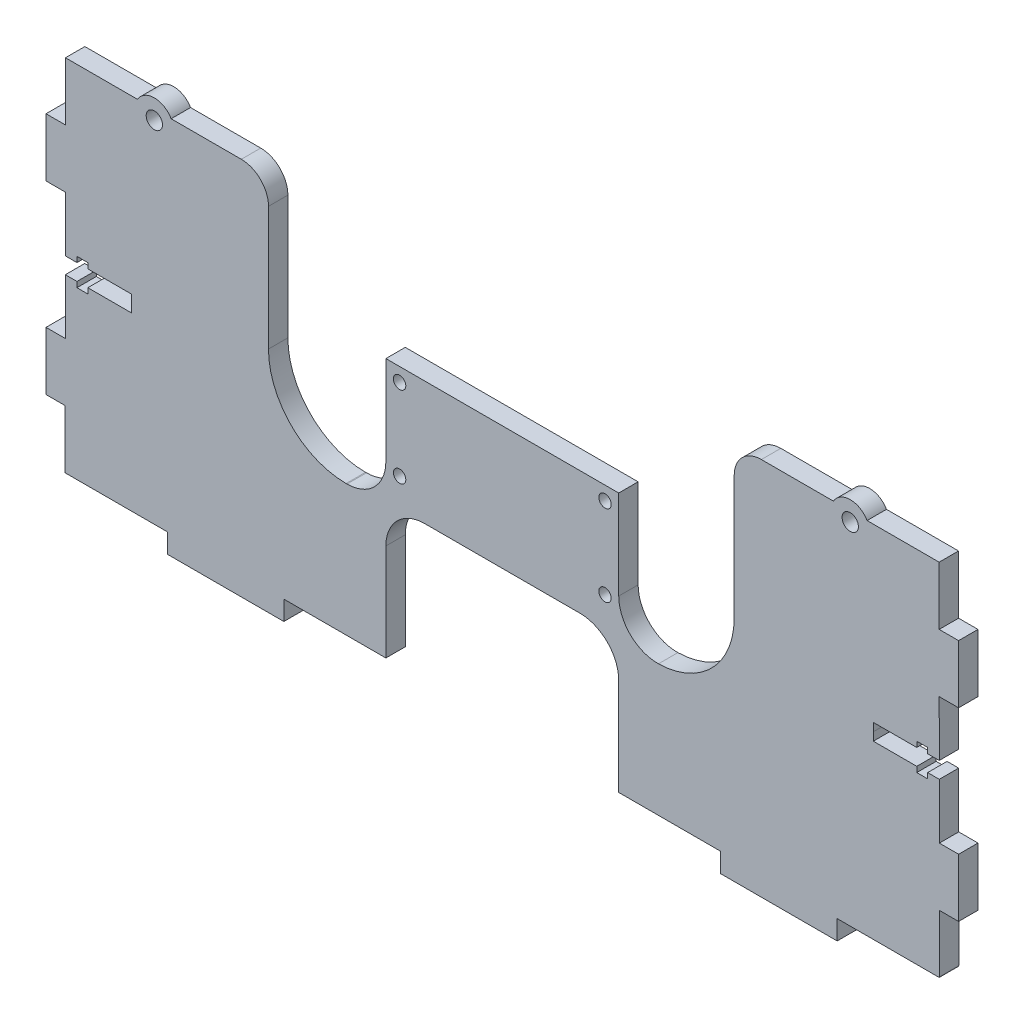
from build123d import *

# Parameters (mm, degrees)
BOSS_EXTRUDE1_DEPTH     = 5
BOSS_EXTRUDE2_START     = -5
BOSS_EXTRUDE2_DEPTH     = 5
CUT_EXTRUDE1_DEPTH      = 5
FILLET1_R               = 7
SKETCH5_W               = 60
SKETCH5_H               = 33
BOSS_EXTRUDE3_DEPTH     = 5
SKETCH6_R               = 1.6
CUT_EXTRUDE2_DEPTH      = 5
CUT_EXTRUDE3_START      = -5
CUT_EXTRUDE3_DEPTH      = 5
CUT_EXTRUDE4_DEPTH      = 10
FILLET2_R               = 10
BOSS_EXTRUDE5_START     = -5
BOSS_EXTRUDE5_OUTLINE_W = 30
BOSS_EXTRUDE5_OUTLINE_H = 5
BOSS_EXTRUDE5_DEPTH     = 5
SKETCH12_W              = 5
SKETCH12_H              = 92.666318873
BOSS_EXTRUDE6_DEPTH     = 5
SKETCH13_W              = 5
SKETCH13_H              = 92.479626066
BOSS_EXTRUDE7_DEPTH     = 11
SKETCH14_W              = 14.125243299
SKETCH14_H              = 18.417399827
SKETCH14_W_2            = 17.448829958
BOSS_EXTRUDE8_DEPTH     = 5
CUT_EXTRUDE5_DEPTH      = 5
SKETCH17_W              = 6.263528668
SKETCH17_H              = 4.2
SKETCH17_W_2            = 6.634448871
CUT_EXTRUDE6_DEPTH      = 5
BOSS_EXTRUDE9_DEPTH     = 5
CUT_EXTRUDE7_DEPTH      = 5
SKETCH21_W              = 3.746111535
SKETCH21_H              = 4.198684894
SKETCH21_W_2            = 4.081394213
SKETCH21_H_2            = 4.198442995
CUT_EXTRUDE8_DEPTH      = 5
BOSS_EXTRUDE10_DEPTH    = 5
SKETCH23_R              = 2.1
CUT_EXTRUDE9_DEPTH      = 5


# Read off the part's stored shape, not the designer's step: Cut-Extrude3, Boss-Extrude5
with BuildPart() as part:
    # Sketch1 → Boss-Extrude1 (new body)
    with BuildSketch(Plane.XY):
        with BuildLine():
            Line((-112.555529977, 89.947234922), (-112.567255319, 76.117234919))
            Line((-112.567255319, 76.117234919), (-109.550918722, 76.117234919))
            Line((-109.550918722, 76.117234919), (-109.550918722, 77.517234919))
            Line((-109.550918722, 77.517234919), (-106.750918722, 77.517234919))
            Line((-106.750918722, 77.517234919), (-106.750918722, 76.117234919))
            Line((-106.750918722, 76.117234919), (-95.550918722, 76.117234919))
            Line((-95.550918722, 76.117234919), (-95.550918722, 71.917234919))
            Line((-95.550918722, 71.917234919), (-106.750918722, 71.917234919))
            Line((-106.750918722, 71.917234919), (-106.750918722, 70.517234919))
            Line((-106.750918722, 70.517234919), (-109.550918722, 70.517234919))
            Line((-109.550918722, 70.517234919), (-109.550918722, 71.917234919))
            Line((-109.550918722, 71.917234919), (-112.5683672, 71.917234919))
            Line((-112.5683672, 71.917234919), (-112.56855454, 63.078549452))
            Line((-112.56855454, 63.078549452), (-112.56855454, 58.070468723))
            ThreePointArc((-112.56855454, 58.070468723), (-109.295273663, 56.47724277), (-107.97, 53.086610624))
            Line((-107.97, 53.086610624), (-107.97, -29.899029756))
            ThreePointArc((-107.97, -29.899029756), (-109.295765386, -33.290194747), (-112.57, -34.883004073))
            Line((-112.57, -34.883004073), (-112.57, -63.301209568))
            Line((-112.57, -63.301209568), (-109.57, -63.301209568))
            Line((-109.57, -63.301209568), (-109.57, -61.901209568))
            Line((-109.57, -61.901209568), (-106.77, -61.901209568))
            Line((-106.77, -61.901209568), (-106.77, -63.301209568))
            Line((-106.77, -63.301209568), (-95.57, -63.301209568))
            Line((-95.57, -63.301209568), (-95.57, -67.501209568))
            Line((-95.57, -67.501209568), (-106.77, -67.501209568))
            Line((-106.77, -67.501209568), (-106.77, -68.901209568))
            Line((-106.77, -68.901209568), (-109.57, -68.901209568))
            Line((-109.57, -68.901209568), (-109.57, -67.501209568))
            Line((-109.57, -67.501209568), (-112.57, -67.501209568))
            Line((-112.57, -67.501209568), (-112.57, -90.906209566))
            Line((-112.57, -90.906209566), (-94.225, -90.906209566))
            Line((-94.225, -90.906209566), (-94.225, -87.906209568))
            Line((-94.225, -87.906209568), (-95.625, -87.906209568))
            Line((-95.625, -87.906209568), (-95.625, -85.106209568))
            Line((-95.625, -85.106209568), (-94.225, -85.106209568))
            Line((-94.225, -85.106209568), (-94.225, -73.906209568))
            Line((-94.225, -73.906209568), (-90.025, -73.906209568))
            Line((-90.025, -73.906209568), (-90.025, -85.106209568))
            Line((-90.025, -85.106209568), (-88.625, -85.106209568))
            Line((-88.625, -85.106209568), (-88.625, -87.906209568))
            Line((-88.625, -87.906209568), (-90.025, -87.906209568))
            Line((-90.025, -87.906209568), (-90.025, -90.906209566))
            Line((-90.025, -90.906209566), (-74.478184725, -90.906209566))
            Line((-74.478184725, -90.906209566), (-58.579544248, -63.368956488))
            Line((-58.579544248, -63.368956488), (-61.177620458, -61.868956489))
            Line((-61.177620458, -61.868956489), (-61.877620458, -63.081392054))
            Line((-61.877620458, -63.081392054), (-64.302491589, -61.681392054))
            Line((-64.302491589, -61.681392054), (-63.602491589, -60.468956489))
            Line((-63.602491589, -60.468956489), (-73.301976111, -54.868956489))
            Line((-73.301976111, -54.868956489), (-71.201976111, -51.231649793))
            Line((-71.201976111, -51.231649793), (-61.502491589, -56.831649793))
            Line((-61.502491589, -56.831649793), (-60.802491589, -55.619214227))
            Line((-60.802491589, -55.619214227), (-58.377620458, -57.019214227))
            Line((-58.377620458, -57.019214227), (-59.077620458, -58.231649793))
            Line((-59.077620458, -58.231649793), (-56.479544248, -59.731649792))
            Line((-56.479544248, -59.731649792), (-39.837168574, -30.906209566))
            Line((-39.837168574, -30.906209566), (-2.099582772, -30.906209566))
            Line((-2.099582772, -30.906209566), (-2.099582772, -27.906209566))
            Line((-2.099582772, -27.906209566), (-3.499582772, -27.906209566))
            Line((-3.499582772, -27.906209566), (-3.499582772, -25.106209566))
            Line((-3.499582772, -25.106209566), (-2.099582772, -25.106209566))
            Line((-2.099582772, -25.106209566), (-2.099582772, -13.906209566))
            Line((-2.099582772, -13.906209566), (2.100417228, -13.906209566))
            Line((2.100417228, -13.906209566), (2.100417228, -25.106209566))
            Line((2.100417228, -25.106209566), (3.500417228, -25.106209566))
            Line((3.500417228, -25.106209566), (3.500417228, -27.906209566))
            Line((3.500417228, -27.906209566), (2.100417228, -27.906209566))
            Line((2.100417228, -27.906209566), (2.100417228, -30.906209566))
            Line((2.100417228, -30.906209566), (39.837168574, -30.906209566))
            Line((39.837168574, -30.906209566), (56.479752862, -59.732011122))
            Line((56.479752862, -59.732011122), (59.078454915, -58.231649793))
            Line((59.078454915, -58.231649793), (58.378454915, -57.019214227))
            Line((58.378454915, -57.019214227), (60.803326045, -55.619214227))
            Line((60.803326045, -55.619214227), (61.503326045, -56.831649793))
            Line((61.503326045, -56.831649793), (71.202810568, -51.231649793))
            Line((71.202810568, -51.231649793), (73.302810568, -54.868956489))
            Line((73.302810568, -54.868956489), (63.603326045, -60.468956489))
            Line((63.603326045, -60.468956489), (64.303326045, -61.681392054))
            Line((64.303326045, -61.681392054), (61.878454915, -63.081392054))
            Line((61.878454915, -63.081392054), (61.178454915, -61.868956489))
            Line((61.178454915, -61.868956489), (58.580378703, -63.368956489))
            Line((58.580378703, -63.368956489), (74.478184725, -90.906209566))
            Line((74.478184725, -90.906209566), (90.025834456, -90.906209566))
            Line((90.025834456, -90.906209566), (90.025834456, -87.906209568))
            Line((90.025834456, -87.906209568), (88.625834456, -87.906209568))
            Line((88.625834456, -87.906209568), (88.625834456, -85.106209568))
            Line((88.625834456, -85.106209568), (90.025834456, -85.106209568))
            Line((90.025834456, -85.106209568), (90.025834456, -73.906209568))
            Line((90.025834456, -73.906209568), (94.225834456, -73.906209568))
            Line((94.225834456, -73.906209568), (94.225834456, -85.106209568))
            Line((94.225834456, -85.106209568), (95.625834456, -85.106209568))
            Line((95.625834456, -85.106209568), (95.625834456, -87.906209568))
            Line((95.625834456, -87.906209568), (94.225834456, -87.906209568))
            Line((94.225834456, -87.906209568), (94.225834456, -90.906209566))
            Line((94.225834456, -90.906209566), (112.57, -90.906209566))
            Line((112.57, -90.906209566), (112.57, -67.501209568))
            Line((112.57, -67.501209568), (109.570834456, -67.501209568))
            Line((109.570834456, -67.501209568), (109.570834456, -68.901209568))
            Line((109.570834456, -68.901209568), (106.770834456, -68.901209568))
            Line((106.770834456, -68.901209568), (106.770834456, -67.501209568))
            Line((106.770834456, -67.501209568), (95.570834456, -67.501209568))
            Line((95.570834456, -67.501209568), (95.570834456, -63.301209568))
            Line((95.570834456, -63.301209568), (106.770834456, -63.301209568))
            Line((106.770834456, -63.301209568), (106.770834456, -61.901209568))
            Line((106.770834456, -61.901209568), (109.570834456, -61.901209568))
            Line((109.570834456, -61.901209568), (109.570834456, -63.301209568))
            Line((109.570834456, -63.301209568), (112.57, -63.301209568))
            Line((112.57, -63.301209568), (112.57, -34.883004073))
            ThreePointArc((112.57, -34.883004073), (109.295765386, -33.290194747), (107.97, -29.899029756))
            Line((107.97, -29.899029756), (107.97, 53.086610624))
            ThreePointArc((107.97, 53.086610624), (109.295273663, 56.47724277), (112.56855454, 58.070468723))
            Line((112.56855454, 58.070468723), (112.56855454, 63.078549452))
            Line((112.56855454, 63.078549452), (112.5683672, 71.917234919))
            Line((112.5683672, 71.917234919), (109.551753179, 71.917234919))
            Line((109.551753179, 71.917234919), (109.551753179, 70.517234919))
            Line((109.551753179, 70.517234919), (106.751753179, 70.517234919))
            Line((106.751753179, 70.517234919), (106.751753179, 71.917234919))
            Line((106.751753179, 71.917234919), (95.551753179, 71.917234919))
            Line((95.551753179, 71.917234919), (95.551753179, 76.117234919))
            Line((95.551753179, 76.117234919), (106.751753179, 76.117234919))
            Line((106.751753179, 76.117234919), (106.751753179, 77.517234919))
            Line((106.751753179, 77.517234919), (109.551753179, 77.517234919))
            Line((109.551753179, 77.517234919), (109.551753179, 76.117234919))
            Line((109.551753179, 76.117234919), (112.550918722, 76.117234919))
            Line((112.550918722, 76.117234919), (112.567303227, 76.060727176))
            Line((112.567303227, 76.060727176), (112.555529977, 89.947234922))
            Line((112.555529977, 89.947234922), (79.201753179, 89.947234922))
            Line((79.201753179, 89.947234922), (79.201753179, 86.947234919))
            Line((79.201753179, 86.947234919), (80.601753179, 86.947234919))
            Line((80.601753179, 86.947234919), (80.601753179, 84.147234919))
            Line((80.601753179, 84.147234919), (79.201753179, 84.147234919))
            Line((79.201753179, 84.147234919), (79.201753179, 72.947234919))
            Line((79.201753179, 72.947234919), (75.001753179, 72.947234919))
            Line((75.001753179, 72.947234919), (75.001753179, 84.147234919))
            Line((75.001753179, 84.147234919), (73.601753179, 84.147234919))
            Line((73.601753179, 84.147234919), (73.601753179, 86.947234919))
            Line((73.601753179, 86.947234919), (75.001753179, 86.947234919))
            Line((75.001753179, 86.947234919), (75.001753179, 89.947234922))
            Line((75.001753179, 89.947234922), (30, 89.947234922))
            Line((30, 89.947234922), (30, 57.382012806))
            Line((30, 57.382012806), (-30, 57.382012806))
            Line((-30, 57.382012806), (-30, 89.947234922))
            Line((-30, 89.947234922), (-75.000918722, 89.947234922))
            Line((-75.000918722, 89.947234922), (-75.000918722, 86.947234919))
            Line((-75.000918722, 86.947234919), (-73.600918722, 86.947234919))
            Line((-73.600918722, 86.947234919), (-73.600918722, 84.147234919))
            Line((-73.600918722, 84.147234919), (-75.000918722, 84.147234919))
            Line((-75.000918722, 84.147234919), (-75.000918722, 72.947234919))
            Line((-75.000918722, 72.947234919), (-79.200918722, 72.947234919))
            Line((-79.200918722, 72.947234919), (-79.200918722, 84.147234919))
            Line((-79.200918722, 84.147234919), (-80.600918722, 84.147234919))
            Line((-80.600918722, 84.147234919), (-80.600918722, 86.947234919))
            Line((-80.600918722, 86.947234919), (-79.200918722, 86.947234919))
            Line((-79.200918722, 86.947234919), (-79.200918722, 89.947234922))
            Line((-79.200918722, 89.947234922), (-112.555529977, 89.947234922))
        make_face()
    extrude(amount=BOSS_EXTRUDE1_DEPTH)

    # Sketch2 → Boss-Extrude2 (add)
    with BuildSketch(Plane.XY.offset(5).offset(BOSS_EXTRUDE2_START)):
        with BuildLine():
            Line((112.56855454, 58.070468723), (112.57, -34.883004073))
            ThreePointArc((112.57, -34.883004073), (109.295765386, -33.290194747), (107.97, -29.899029756))
            Line((107.97, -29.899029756), (107.97, 53.086610624))
            ThreePointArc((107.97, 53.086610624), (109.295273663, 56.47724277), (112.56855454, 58.070468723))
        make_face()
        with BuildLine():
            Line((-112.57, -34.883004073), (-112.56855454, 58.070468723))
            ThreePointArc((-112.56855454, 58.070468723), (-109.295273663, 56.47724277), (-107.97, 53.086610624))
            Line((-107.97, 53.086610624), (-107.97, -29.899029756))
            ThreePointArc((-107.97, -29.899029756), (-109.295765386, -33.290194747), (-112.57, -34.883004073))
        make_face()
    extrude(amount=BOSS_EXTRUDE2_DEPTH)

    # Sketch3 → Cut-Extrude1 (cut)
    with BuildSketch(Plane.XY.offset(5)):
        with BuildLine():
            Line((59.755598965, 89.947234922), (-60.244401035, 89.947234922))
            Line((-60.244401035, 89.947234922), (-60.244401035, 51.100894588))
            ThreePointArc((-60.244401035, 51.100894588), (-54.386536659, 36.958758964), (-40.244401035, 31.100894588))
            Line((-40.244401035, 31.100894588), (39.755598965, 31.100894588))
            ThreePointArc((39.755598965, 31.100894588), (53.897734588, 36.958758964), (59.755598965, 51.100894588))
            Line((59.755598965, 51.100894588), (59.755598965, 89.947234922))
        make_face()
    extrude(amount=-CUT_EXTRUDE1_DEPTH, mode=Mode.SUBTRACT)

    # Fillet1
    fillet1_edges = [part.edges().sort_by_distance(p)[0] for p in [
        (-60.244401035, 89.947234922, 2.5),
        (59.755598965, 89.947234922, 2.5),
    ]]
    fillet(fillet1_edges, radius=FILLET1_R)

    # Sketch5 → Boss-Extrude3 (add)
    with BuildSketch(Plane.XY.offset(5)):
        with Locations((-6.023e-06, 47.600894588)):
            Rectangle(SKETCH5_W, SKETCH5_H)
    extrude(amount=-BOSS_EXTRUDE3_DEPTH)

    # Sketch6 → Cut-Extrude2 (cut)
    with BuildSketch(Plane.XY.offset(5)):
        with Locations((-26.464472117, 60.565360682)):
            Circle(SKETCH6_R)
        with Locations((-26.464472117, 39.636428494)):
            Circle(SKETCH6_R)
        with Locations((26.464460071, 60.565360682)):
            Circle(SKETCH6_R)
        with Locations((26.464460071, 39.636428494)):
            Circle(SKETCH6_R)
    extrude(amount=-CUT_EXTRUDE2_DEPTH, mode=Mode.SUBTRACT)

    # Cut-Extrude3 outline → Cut-Extrude3 (cut)
    with BuildSketch(Plane.XY.offset(5).offset(CUT_EXTRUDE3_START)):
        Polygon((112.56949984, -2.719105412), (-112.56949984, -2.719105412), (-112.57, -34.883004073), (-112.57, -63.301209568), (-109.57, -63.301209568), (-109.57, -61.901209568), (-106.77, -61.901209568), (-106.77, -63.301209568), (-95.57, -63.301209568), (-95.57, -67.501209568), (-106.77, -67.501209568), (-106.77, -68.901209568), (-109.57, -68.901209568), (-109.57, -67.501209568), (-112.57, -67.501209568), (-112.57, -90.906209566), (-94.225, -90.906209566), (-94.225, -87.906209568), (-95.625, -87.906209568), (-95.625, -85.106209568), (-94.225, -85.106209568), (-94.225, -73.906209568), (-90.025, -73.906209568), (-90.025, -85.106209568), (-88.625, -85.106209568), (-88.625, -87.906209568), (-90.025, -87.906209568), (-90.025, -90.906209566), (-74.478184725, -90.906209566), (-58.579544248, -63.368956488), (-61.177620458, -61.868956489), (-61.877620458, -63.081392054), (-64.302491589, -61.681392054), (-63.602491589, -60.468956489), (-73.301976111, -54.868956489), (-71.201976111, -51.231649793), (-61.502491589, -56.831649793), (-60.802491589, -55.619214227), (-58.377620458, -57.019214227), (-59.077620458, -58.231649793), (-56.479544248, -59.731649792), (-39.837168574, -30.906209566), (-2.099582772, -30.906209566), (-2.099582772, -27.906209566), (-3.499582772, -27.906209566), (-3.499582772, -25.106209566), (-2.099582772, -25.106209566), (-2.099582772, -13.906209566), (2.100417228, -13.906209566), (2.100417228, -25.106209566), (3.500417228, -25.106209566), (3.500417228, -27.906209566), (2.100417228, -27.906209566), (2.100417228, -30.906209566), (39.837168574, -30.906209566), (56.479752862, -59.732011122), (59.078454915, -58.231649793), (58.378454915, -57.019214227), (60.803326045, -55.619214227), (61.503326045, -56.831649793), (71.202810568, -51.231649793), (73.302810568, -54.868956489), (63.603326045, -60.468956489), (64.303326045, -61.681392054), (61.878454915, -63.081392054), (61.178454915, -61.868956489), (58.580378703, -63.368956489), (58.579752591, -63.369317348), (74.478184725, -90.906209566), (90.025834456, -90.906209566), (90.025834456, -87.906209568), (88.625834456, -87.906209568), (88.625834456, -85.106209568), (90.025834456, -85.106209568), (90.025834456, -73.906209568), (94.225834456, -73.906209568), (94.225834456, -85.106209568), (95.625834456, -85.106209568), (95.625834456, -87.906209568), (94.225834456, -87.906209568), (94.225834456, -90.906209566), (112.57, -90.906209566), (112.57, -67.501209568), (109.570834456, -67.501209568), (109.570834456, -68.901209568), (106.770834456, -68.901209568), (106.770834456, -67.501209568), (95.570834456, -67.501209568), (95.570834456, -63.301209568), (106.770834456, -63.301209568), (106.770834456, -61.901209568), (109.570834456, -61.901209568), (109.570834456, -63.301209568), (112.57, -63.301209568), (112.57, -34.883004073), align=None)
    extrude(amount=CUT_EXTRUDE3_DEPTH, mode=Mode.SUBTRACT)

    # Sketch10 → Cut-Extrude4 (cut)
    with BuildSketch(Plane.XY.offset(5)):
        with BuildLine():
            Line((-30.000006023, -2.719105412), (29.999993977, -2.719105412))
            Line((29.999993977, -2.719105412), (29.999993977, 22.280894588))
            ThreePointArc((29.999993977, 22.280894588), (27.071061789, 29.3519624), (19.999993977, 32.280894588))
            Line((19.999993977, 32.280894588), (-20.000006023, 32.280894588))
            ThreePointArc((-20.000006023, 32.280894588), (-27.071073835, 29.3519624), (-30.000006023, 22.280894588))
            Line((-30.000006023, 22.280894588), (-30.000006023, -2.719105412))
        make_face()
    extrude(amount=-CUT_EXTRUDE4_DEPTH, mode=Mode.SUBTRACT)

    # Fillet2
    fillet2_edges = [part.edges().sort_by_distance(p)[0] for p in [
        (29.999993977, 31.100894588, 2.5),
        (-30.000006023, 31.100894588, 2.5),
    ]]
    fillet(fillet2_edges, radius=FILLET2_R)

    # Boss-Extrude5 outline → Boss-Extrude5 (add)
    with BuildSketch(Plane.XY.offset(5).offset(BOSS_EXTRUDE5_START)):
        with Locations((71.284746908, -5.219105412)):
            Rectangle(BOSS_EXTRUDE5_OUTLINE_W, BOSS_EXTRUDE5_OUTLINE_H)
        Polygon((117.569266584, 27.280894588), (112.569033329, 27.280894588), (112.569266585, 12.280894588), (117.569266584, 12.280894588), align=None)
        Polygon((112.56855454, 59.947234922), (117.56862091, 59.947234922), (117.56862091, 74.947234922), (112.564823831, 74.947234922), (112.564823831, 76.069278248), (112.550918722, 76.117234919), (109.551753179, 76.117234919), (109.551753179, 77.517234919), (106.751753179, 77.517234919), (106.751753179, 76.117234919), (95.551753179, 76.117234919), (95.551753179, 71.917234919), (106.751753179, 71.917234919), (106.751753179, 70.517234919), (109.551753179, 70.517234919), (109.551753179, 71.917234919), (112.5683672, 71.917234919), (112.56855454, 63.078549452), align=None)
        with Locations((-71.284746908, -5.219105412)):
            Rectangle(BOSS_EXTRUDE5_OUTLINE_W, BOSS_EXTRUDE5_OUTLINE_H)
        Polygon((-112.569266585, 12.280894588), (-112.569033329, 27.280894588), (-117.569266584, 27.280894588), (-117.569266584, 12.280894588), align=None)
        Polygon((-117.56862091, 59.947234922), (-112.56855454, 59.947234922), (-112.56855454, 63.078549452), (-112.5683672, 71.917234919), (-109.550918722, 71.917234919), (-109.550918722, 70.517234919), (-106.750918722, 70.517234919), (-106.750918722, 71.917234919), (-95.550918722, 71.917234919), (-95.550918722, 76.117234919), (-106.750918722, 76.117234919), (-106.750918722, 77.517234919), (-109.550918722, 77.517234919), (-109.550918722, 76.117234919), (-112.550918722, 76.117234919), (-112.563061404, 76.0753566), (-112.563061404, 74.947234922), (-117.56862091, 74.947234922), align=None)
    extrude(amount=BOSS_EXTRUDE5_DEPTH)

    # Sketch12 → Boss-Extrude6 (add)
    with BuildSketch(Plane(origin=(-112.631708027, 0.095491345, 0), x_dir=(0, 0, 1), z_dir=(-0.999999640601339, 0.0008478190804530466, 0))):
        with Locations((2.5, 43.518616433)):
            Rectangle(SKETCH12_W, SKETCH12_H)
    extrude(amount=-BOSS_EXTRUDE6_DEPTH)

    # Sketch13 → Boss-Extrude7 (add)
    with BuildSketch(Plane(origin=(112.631708027, 0.095491345, 0), x_dir=(0, 0, -1), z_dir=(0.999999640601339, 0.0008478190804733425, 0))):
        with Locations((-2.5, 43.611962836)):
            Rectangle(SKETCH13_W, SKETCH13_H)
    extrude(amount=-BOSS_EXTRUDE7_DEPTH)

    # Sketch14 → Boss-Extrude8 (add)
    with BuildSketch(Plane.XY.offset(5)):
        with Locations((-76.769807505, 80.738535009)):
            Rectangle(SKETCH14_W, SKETCH14_H)
        with Locations((77.36152379, 80.738535009)):
            Rectangle(SKETCH14_W_2, SKETCH14_H)
    extrude(amount=-BOSS_EXTRUDE8_DEPTH)

    # Sketch16 → Cut-Extrude5 (cut)
    with BuildSketch(Plane.XY.offset(5)):
        Polygon((-112.594812137, 43.614064755), (-112.593031716, 45.714064755), (-107.593029919, 45.714064755), (-107.590571243, 48.614064755), (-97.590571243, 48.614064755), (-97.590571243, 38.614064755), (-107.590571243, 38.614064755), (-107.593029919, 41.514064755), (-112.593031716, 41.514064755), align=None)
        Polygon((112.594812137, 43.614064755), (112.593031716, 41.514064755), (107.593029919, 41.514064755), (107.590571243, 38.614064755), (97.590571243, 38.614064755), (97.590571243, 48.614064755), (107.590571243, 48.614064755), (107.593029919, 45.714064755), (112.593031716, 45.714064755), align=None)
    extrude(amount=-CUT_EXTRUDE5_DEPTH, mode=Mode.SUBTRACT)

    # Sketch17 → Cut-Extrude6 (cut)
    with BuildSketch(Plane.XY.offset(5)):
        with Locations((-110.724794253, 43.614064755)):
            Rectangle(SKETCH17_W, SKETCH17_H)
        with Locations((110.910254355, 43.614064755)):
            Rectangle(SKETCH17_W_2, SKETCH17_H)
    extrude(amount=-CUT_EXTRUDE6_DEPTH, mode=Mode.SUBTRACT)

    # Sketch19 → Boss-Extrude9 (add)
    with BuildSketch(Plane.XY.offset(5)):
        Polygon((97.590571243, 38.614064755), (107.590571243, 38.614064755), (107.593029919, 41.514064755), (112.596592557, 41.514064755), (112.593031716, 45.714064755), (107.593029919, 45.714064755), (107.590571243, 48.614064755), (97.590571243, 48.614064755), align=None)
        Polygon((-112.596592557, 41.514064755), (-107.593029919, 41.514064755), (-107.590571243, 38.614064755), (-97.590571243, 38.614064755), (-97.590571243, 48.614064755), (-107.590571243, 48.614064755), (-107.593029919, 45.714064755), (-112.593031716, 45.714064755), align=None)
    extrude(amount=-BOSS_EXTRUDE9_DEPTH)

    # Sketch20 → Cut-Extrude7 (cut)
    with BuildSketch(Plane.XY.offset(5)):
        Polygon((-112.594812137, 43.614064755), (-112.593031716, 45.714064755), (-109.593030638, 45.714064755), (-109.591843691, 47.114064755), (-106.791843691, 47.114064755), (-106.791843691, 45.714064755), (-95.593025606, 45.714064755), (-95.594806027, 43.614064755), (-95.593025606, 41.514064755), (-106.791843691, 41.514064755), (-106.791843691, 40.114064755), (-109.591843691, 40.114064755), (-109.593030638, 41.514064755), (-112.593031716, 41.514064755), align=None)
        Polygon((112.594812137, 43.614064755), (112.593031716, 41.514064755), (109.593030638, 41.514064755), (109.591843691, 40.114064755), (106.791843691, 40.114064755), (106.791843691, 41.514064755), (95.593025606, 41.514064755), (95.594806027, 43.614064755), (95.593025606, 45.714064755), (106.791843691, 45.714064755), (106.791843691, 47.114064755), (109.591843691, 47.114064755), (109.593030638, 45.714064755), (112.593031716, 45.714064755), align=None)
    extrude(amount=-CUT_EXTRUDE7_DEPTH, mode=Mode.SUBTRACT)

    # Sketch21 → Cut-Extrude8 (cut)
    with BuildSketch(Plane.XY.offset(5)):
        with Locations((-112.274699266, 43.614722308)):
            Rectangle(SKETCH21_W, SKETCH21_H)
        with Locations((112.392365081, 43.614843257)):
            Rectangle(SKETCH21_W_2, SKETCH21_H_2)
    extrude(amount=-CUT_EXTRUDE8_DEPTH, mode=Mode.SUBTRACT)

    # Sketch22 → Boss-Extrude10 (add)
    with BuildSketch(Plane.XY.offset(5)):
        with BuildLine():
            Line((93.98569149, 89.947234922), (85.325437452, 89.947234922))
            ThreePointArc((85.325437452, 89.947234922), (89.655564471, 92.447234922), (93.98569149, 89.947234922))
        make_face()
        with BuildLine():
            Line((-93.98569149, 89.947234922), (-85.325437452, 89.947234922))
            ThreePointArc((-85.325437452, 89.947234922), (-89.655564471, 92.447234922), (-93.98569149, 89.947234922))
        make_face()
    extrude(amount=-BOSS_EXTRUDE10_DEPTH)

    # Sketch23 → Cut-Extrude9 (cut)
    with BuildSketch(Plane.XY.offset(5)):
        with Locations((89.655564471, 87.447234922)):
            Circle(SKETCH23_R)
        with Locations((-89.655564471, 87.447234922)):
            Circle(SKETCH23_R)
    extrude(amount=-CUT_EXTRUDE9_DEPTH, mode=Mode.SUBTRACT)


solid = part.part
